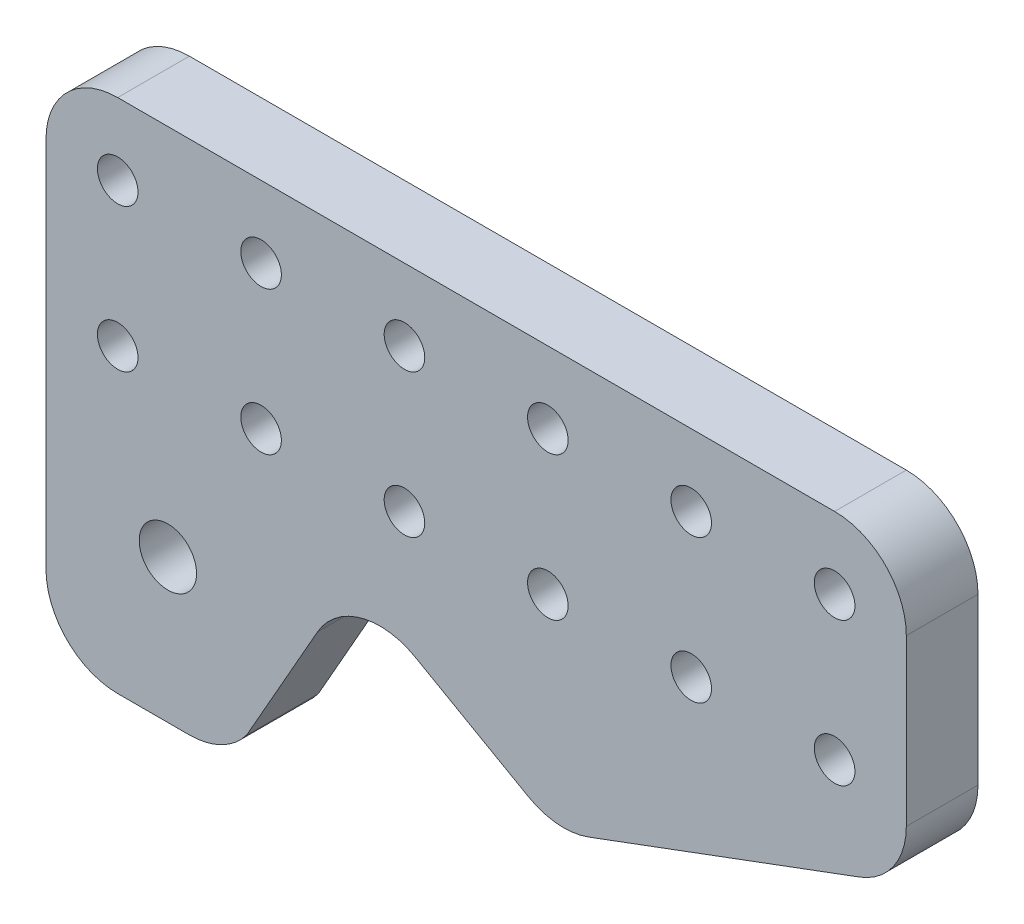
from build123d import *

# Parameters (mm, degrees)
SKETCH1_R           = 2.54
SKETCH1_R_2         = 1.797730585
BOSS_EXTRUDE1_DEPTH = 6.35
CUT_EXTRUDE1_DEPTH  = 90.090296329
FILLET1_R           = 6.35


with BuildPart() as part:
    # Sketch1 → Boss-Extrude1 (new body)
    with BuildSketch(Plane.XY):
        Polygon((21.59, 0), (76.2, 20.32), (76.2, 45.72), (0, 45.72), (0, 0), align=None)
        with Locations((10.795, 12.7)):
            Circle(SKETCH1_R, mode=Mode.SUBTRACT)
        with Locations((69.85, 39.37)):
            Circle(SKETCH1_R_2, mode=Mode.SUBTRACT)
        with Locations((57.15, 39.37)):
            Circle(SKETCH1_R_2, mode=Mode.SUBTRACT)
        with Locations((44.45, 39.37)):
            Circle(SKETCH1_R_2, mode=Mode.SUBTRACT)
        with Locations((31.75, 39.37)):
            Circle(SKETCH1_R_2, mode=Mode.SUBTRACT)
        with Locations((19.05, 39.37)):
            Circle(SKETCH1_R_2, mode=Mode.SUBTRACT)
        with Locations((6.35, 39.37)):
            Circle(SKETCH1_R_2, mode=Mode.SUBTRACT)
        with Locations((57.15, 26.67)):
            Circle(SKETCH1_R_2, mode=Mode.SUBTRACT)
        with Locations((44.45, 26.67)):
            Circle(SKETCH1_R_2, mode=Mode.SUBTRACT)
        with Locations((31.75, 26.67)):
            Circle(SKETCH1_R_2, mode=Mode.SUBTRACT)
        with Locations((19.05, 26.67)):
            Circle(SKETCH1_R_2, mode=Mode.SUBTRACT)
        with Locations((6.35, 26.67)):
            Circle(SKETCH1_R_2, mode=Mode.SUBTRACT)
        with Locations((69.85, 26.67)):
            Circle(SKETCH1_R_2, mode=Mode.SUBTRACT)
    extrude(amount=BOSS_EXTRUDE1_DEPTH)

    # Sketch2 → Cut-Extrude1 (cut, through all)
    with BuildSketch(Plane.XY.offset(6.35)):
        Polygon((17.78, 0), (17.78, 2.54), (27.186735348, 19.105501202), (45.29738426, 8.821352283), (21.59, 0), align=None)
    extrude(amount=-CUT_EXTRUDE1_DEPTH, mode=Mode.SUBTRACT)

    # Fillet1
    # the kernel refuses this fillet: 6.35 mm, written as the material it adds along each edge
    with BuildSketch(Plane(origin=(27.186735348, 19.105501202, 6.35), x_dir=(0.8695801156095444, -0.4937918818049677, 0), z_dir=(0, 0, -1))) as fillet1_piece_1:
        with BuildLine():
            CenterArc((FILLET1_R, FILLET1_R), FILLET1_R, 180, 90)
            Line((0, FILLET1_R), (0, 0))
            Line((0, 0), (FILLET1_R, 0))
        make_face()
    extrude(amount=6.35)
    # the kernel refuses this fillet: 6.35 mm, written as the material it takes off along each edge
    with BuildSketch(Plane(origin=(45.29738426, 8.821352283, 13.752634073), x_dir=(0.9372218510575621, 0.3487337120214175, 0), z_dir=(0, 0, -1))) as fillet1_2_piece_1:
        with BuildLine():
            CenterArc((FILLET1_R * 0.466307658155, -FILLET1_R), FILLET1_R, 90, 50)
            Line((-FILLET1_R * 0.299736784964, -FILLET1_R * 0.357212390313), (0, 0))
            Line((0, 0), (FILLET1_R * 0.466307658155, 0))
        make_face()
    extrude(amount=21.155268146, mode=Mode.SUBTRACT)
    with BuildSketch(Plane(origin=(76.2, 20.32, -11.031382068), x_dir=(-0.9372218510575616, -0.34873371202141845, 0), z_dir=(0, 0, 1))) as fillet1_2_piece_2:
        with BuildLine():
            CenterArc((FILLET1_R * 0.694890209019, -FILLET1_R), FILLET1_R, 90, 69.590117166)
            Line((-FILLET1_R * 0.242331642039, -FILLET1_R * 0.651266287979), (0, 0))
            Line((0, 0), (FILLET1_R * 0.694890209019, 0))
        make_face()
    extrude(amount=28.412764136, mode=Mode.SUBTRACT)
    with BuildSketch(Plane(origin=(76.2, 45.72, -15.875), x_dir=(0, -1, 0), z_dir=(0, 0, 1))) as fillet1_2_piece_3:
        with BuildLine():
            CenterArc((FILLET1_R, -FILLET1_R), FILLET1_R, 90, 90)
            Line((0, -FILLET1_R), (0, 0))
            Line((0, 0), (FILLET1_R, 0))
        make_face()
    extrude(amount=38.1, mode=Mode.SUBTRACT)
    with BuildSketch(Plane(origin=(0, 45.72, -15.875), x_dir=(0, -1, 0), z_dir=(0, 0, 1)), Plane(origin=(0, 0, -15.875), x_dir=(1, 0, 0), z_dir=(0, 0, 1))) as fillet1_2_piece_4:
        with BuildLine():
            CenterArc((FILLET1_R, FILLET1_R), FILLET1_R, 180, 90)
            Line((0, FILLET1_R), (0, 0))
            Line((0, 0), (FILLET1_R, 0))
        make_face()
    extrude(amount=38.1, mode=Mode.SUBTRACT)
    with BuildSketch(Plane(origin=(17.78, 0, 19.05), x_dir=(0, 1, 0), z_dir=(0, 0, -1))) as fillet1_2_piece_5:
        with BuildLine():
            CenterArc((6.35, -5.08), FILLET1_R, 126.869897646, 53.130102354)
            Line((0, -5.08), (0, 0))
            Line((0, 0), (2.54, 0))
        make_face()
    extrude(amount=31.75, mode=Mode.SUBTRACT)


solid = part.part
